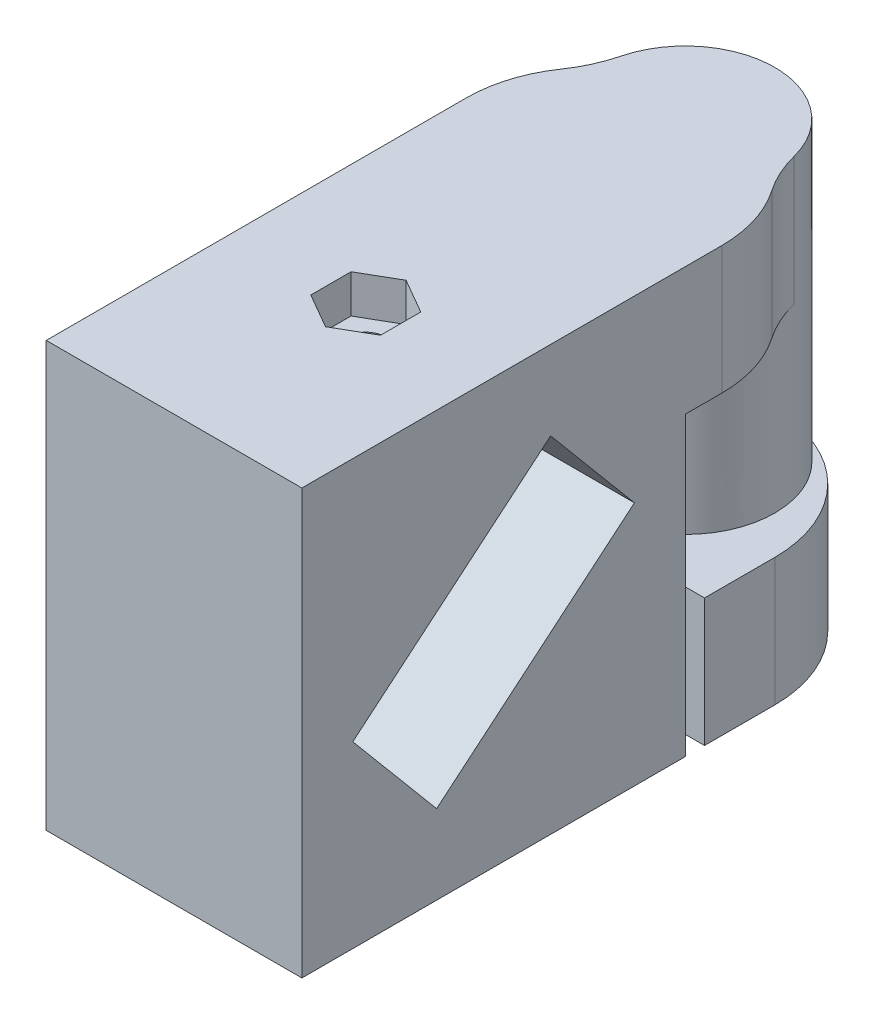
from build123d import *

# Parameters (mm, degrees)
SKETCH_1_W                      = 20
SKETCH_1_H                      = 30
EXTRUDE_1_DEPTH                 = 33.2
SKETCH_2_R                      = 1.5
CUT_EXTRUDE_1_DEPTH             = 38.778830051
CUT_EXTRUDE_4_DEPTH             = 30
SKETCH1_W                       = 20
SKETCH1_H                       = 10
BOSS_EXTRUDE2_DEPTH             = 10
BOSS_EXTRUDE3_REACH             = 37.542
SKETCH2_R                       = 7
BOSS_EXTRUDE3_DIRECTION_2_REACH = 37.542
FILLET1_R                       = 10
SKETCH3_W                       = 20
SKETCH3_H                       = 15.5
BOSS_EXTRUDE4_DEPTH             = 10
FILLET2_R                       = 10
SKETCH4_R                       = 3.15
CUT_EXTRUDE1_DEPTH              = 3
CUT_EXTRUDE2_DEPTH              = 3


with BuildPart() as part:
    # Эскиз1 → Бобышка-Вытянуть1 (new body)
    with BuildSketch(Plane(origin=(0, 0, 0), x_dir=(1, 0, 0), z_dir=(0, 1, 0))):
        Rectangle(SKETCH_1_W, SKETCH_1_H)
    extrude(amount=EXTRUDE_1_DEPTH)

    # Эскиз2 → Вырез-Вытянуть1 (cut, through all)
    with BuildSketch(Plane(origin=(0, 33.2, 0), x_dir=(1, 0, 0), z_dir=(0, 1, 0))):
        with Locations(Location((0, 0, 0), (0, 0, 270))):
            Circle(SKETCH_2_R)
    extrude(amount=-CUT_EXTRUDE_1_DEPTH, mode=Mode.SUBTRACT)

    # Эскиз5 → Вырез-Вытянуть4 (cut)
    with BuildSketch(Plane.ZY.offset(10)):
        Polygon((-4.458832066, 26.998981518), (-11.015265685, 19.185328198), (4.458832066, 6.201018482), (11.015265685, 14.014671802), align=None)
    extrude(amount=-CUT_EXTRUDE_4_DEPTH, mode=Mode.SUBTRACT)

    # Sketch1 → Boss-Extrude2 (add)
    with BuildSketch(Plane(origin=(0, 0, -15), x_dir=(-1, 0, 0), z_dir=(0, 0, -1))):
        with Locations((0, 28.2)):
            Rectangle(SKETCH1_W, SKETCH1_H)
    extrude(amount=BOSS_EXTRUDE2_DEPTH)

    # Boss-Extrude3: up to this face of the body (flat: up to its plane)
    boss_extrude3_end = Plane(part.part.faces().sort_by_distance((0, 0, 14.639444872))[0])
    # Sketch2 → Boss-Extrude3 (add, up to the picked face)
    with BuildSketch(Plane.XZ.offset(-23.2), mode=Mode.PRIVATE) as boss_extrude3_sk1:
        with Locations((0, -25)):
            Circle(SKETCH2_R)
    boss_extrude3_tool1 = split(extrude(boss_extrude3_sk1.sketch, amount=BOSS_EXTRUDE3_REACH, mode=Mode.PRIVATE), bisect_by=boss_extrude3_end, keep=Keep.BOTH, mode=Mode.PRIVATE)
    add(boss_extrude3_tool1.solids().sort_by(Axis((0, 23.2, -25), (0, -1, 0)))[0])

    # Boss-Extrude3 direction 2: up to this face of the body (flat: up to its plane)
    boss_extrude3_direction_2_end = Plane(part.part.faces().sort_by_distance((0, 33.2, -5.044572477))[0])
    # Sketch2 → Boss-Extrude3 direction 2 (add, up to the picked face)
    with BuildSketch(Plane.XZ.offset(-23.2), mode=Mode.PRIVATE) as boss_extrude3_direction_2_sk1:
        with Locations((0, -25)):
            Circle(SKETCH2_R)
    boss_extrude3_direction_2_tool1 = split(extrude(boss_extrude3_direction_2_sk1.sketch, amount=-BOSS_EXTRUDE3_DIRECTION_2_REACH, mode=Mode.PRIVATE), bisect_by=boss_extrude3_direction_2_end, keep=Keep.BOTH, mode=Mode.PRIVATE)
    add(boss_extrude3_direction_2_tool1.solids().sort_by(Axis((0, 23.2, -25), (0, 1, 0)))[0])

    # Fillet1
    # the kernel refuses this fillet: 10 mm, written as the material it takes off along each edge
    with BuildSketch(Plane(origin=(-10, 5.346428929, -25), x_dir=(0, 0, 1), z_dir=(0, 1, 0)), Plane(origin=(10, 51.053571071, -25), x_dir=(0, 0, 1), z_dir=(0, -1, 0))) as fillet1_piece_1:
        with BuildLine():
            CenterArc((7.141428429, 10), FILLET1_R, 224.427004001, 45.572995999)
            Line((0, 3), (-0.142828569, 2.86))
            ThreePointArc((-0.142828569, 2.86), (-0.2, 1.5), (-0.2, 0))
            Line((-0.2, 0), (0, -0.2))
            Line((0, -0.2), (7.141428429, -0.2))
            Line((7.141428429, -0.2), (7.141428429, 0))
        make_face()
    extrude(amount=45.707142143, mode=Mode.SUBTRACT)

    # Sketch3 → Boss-Extrude4 (add)
    with BuildSketch(Plane.XZ):
        with Locations((0, -24.25)):
            Rectangle(SKETCH3_W, SKETCH3_H)
    extrude(amount=-BOSS_EXTRUDE4_DEPTH)

    # Fillet2
    # the kernel refuses this fillet: 10 mm, written as the material it adds along each edge
    with BuildSketch(Plane(origin=(7, 23.2, -25), x_dir=(0.6436039974439222, 0, 0.7653586704769234), z_dir=(0, 1, 0))) as fillet2_piece_1:
        with BuildLine():
            CenterArc((2.881578556, 9.953762577), FILLET2_R, 244.245370549, 20.242721963)
            ThreePointArc((-1.463601761, 0.947131242), (-0.702200702, 0.519306771), (0, 0))
            ThreePointArc((0, 0), (0.960526185, 0.046237423), (1.921052371, 0))
        make_face()
    extrude(amount=10)
    with BuildSketch(Plane(origin=(-7, 33.2, -25), x_dir=(0.12452332997196464, 0, -0.9922166801121081), z_dir=(0, -1, 0))) as fillet2_piece_2:
        with BuildLine():
            CenterArc((2.988559919, -9.922166801), FILLET2_R, 97.153229531, 20.242721963)
            ThreePointArc((-1.612810589, -1.043687796), (-0.781284983, -0.560662311), (0, 0))
            ThreePointArc((0, 0), (0.87166331, -0.054483239), (1.74332662, 0))
        make_face()
    extrude(amount=10)
    # the kernel refuses this fillet: 10 mm, written as the material it takes off along each edge
    with BuildSketch(Plane(origin=(10, -25, -32), x_dir=(0, 0, 1), z_dir=(0, 1, 0)), Plane(origin=(-10, -25, -32), x_dir=(1, 0, 0), z_dir=(0, 1, 0))) as fillet2_2_piece_1:
        with BuildLine():
            CenterArc((FILLET2_R, -FILLET2_R), FILLET2_R, 90, 90)
            Line((0, -FILLET2_R), (0, 0))
            Line((0, 0), (FILLET2_R, 0))
        make_face()
    extrude(amount=60, mode=Mode.SUBTRACT)

    # Sketch4 → Cut-Extrude1 (cut)
    with BuildSketch(Plane.XZ):
        with Locations(Location((0, 0, 0), (0, 0, 270))):
            Circle(SKETCH4_R)
    extrude(amount=-CUT_EXTRUDE1_DEPTH, mode=Mode.SUBTRACT)

    # Sketch5 → Cut-Extrude2 (cut)
    with BuildSketch(Plane(origin=(0, 33.2, 0), x_dir=(1, 0, 0), z_dir=(0, 1, 0))):
        Polygon((0, 3.15), (-2.727980022, 1.575), (-2.727980022, -1.575), (0, -3.15), (2.727980022, -1.575), (2.727980022, 1.575), align=None)
    extrude(amount=-CUT_EXTRUDE2_DEPTH, mode=Mode.SUBTRACT)


solid = part.part
